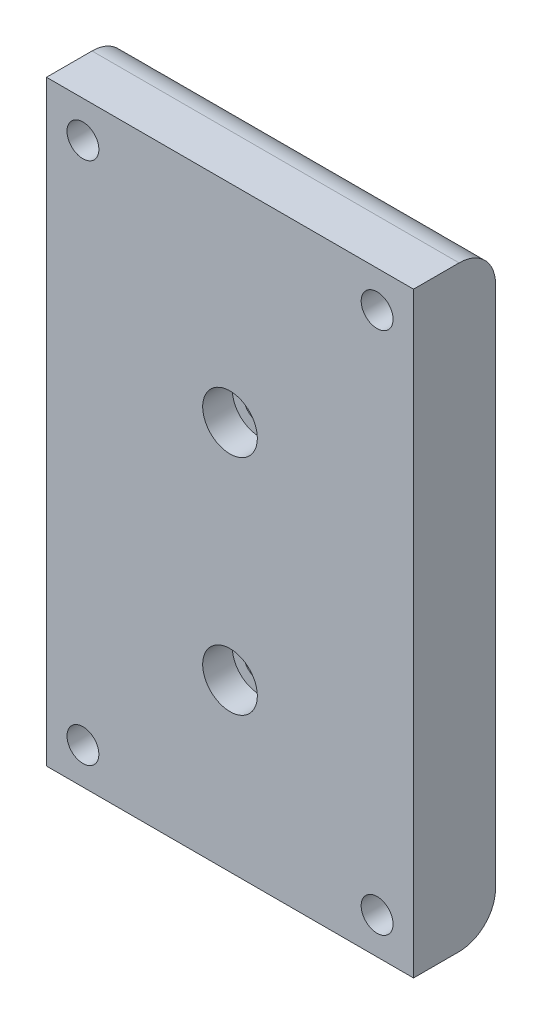
from build123d import *

# Parameters (mm, degrees)
SKETCH1_W           = 40.3
SKETCH1_H           = 65.5
BOSS_EXTRUDE1_DEPTH = 9
CUT_EXTRUDE2_DEPTH  = 4.5
SKETCH3_R           = 1.75
CUT_EXTRUDE5_DEPTH  = 78.03629015
SKETCH5_R           = 3
CUT_EXTRUDE6_DEPTH  = 3.25
FILLET1_R           = 4
SKETCH6_R           = 1.75
CUT_EXTRUDE7_DEPTH  = 78.429580911
SKETCH7_R           = 3
CUT_EXTRUDE8_DEPTH  = 3


with BuildPart() as part:
    # Sketch1 → Boss-Extrude1 (new body)
    with BuildSketch(Plane.XY):
        with Locations((20.15, 32.75)):
            Rectangle(SKETCH1_W, SKETCH1_H)
    extrude(amount=BOSS_EXTRUDE1_DEPTH)

    # Sketch2 → Cut-Extrude2 (cut)
    with BuildSketch(Plane(origin=(0, 0, 0), x_dir=(-1, 0, 0), z_dir=(0, 0, -1))):
        with BuildLine():
            Line((-24.65, 18.25), (-24.65, 32.084635496))
            ThreePointArc((-24.65, 32.084635496), (-25.148538124, 35.202683318), (-26.594444444, 38.009837998))
            ThreePointArc((-26.594444444, 38.009837998), (-20.15, 50.75), (-13.705555556, 38.009837998))
            ThreePointArc((-13.705555556, 38.009837998), (-15.151461876, 35.202683318), (-15.65, 32.084635496))
            Line((-15.65, 32.084635496), (-15.65, 18.25))
            ThreePointArc((-15.65, 18.25), (-20.15, 13.75), (-24.65, 18.25))
        make_face()
    extrude(amount=-CUT_EXTRUDE2_DEPTH, mode=Mode.SUBTRACT)

    # Sketch3 → Cut-Extrude5 (cut, through all)
    with BuildSketch(Plane(origin=(0, 0, 4.5), x_dir=(-1, 0, 0), z_dir=(0, 0, -1))):
        with Locations((-20.15, 18.25)):
            Circle(SKETCH3_R)
        with Locations((-20.15, 42.75)):
            Circle(SKETCH3_R)
    extrude(amount=-CUT_EXTRUDE5_DEPTH, mode=Mode.SUBTRACT)

    # Sketch5 → Cut-Extrude6 (cut)
    with BuildSketch(Plane.XY.offset(9)):
        with Locations((20.15, 18.25)):
            Circle(SKETCH5_R)
        with Locations((20.15, 42.75)):
            Circle(SKETCH5_R)
    extrude(amount=-CUT_EXTRUDE6_DEPTH, mode=Mode.SUBTRACT)

    # Fillet1
    fillet1_edges = [part.edges().sort_by_distance(p)[0] for p in [
        (20.15, 0, 0),
        (20.15, 65.5, 0),
    ]]
    fillet(fillet1_edges, radius=FILLET1_R)

    # Sketch6 → Cut-Extrude7 (cut, through all)
    with BuildSketch(Plane(origin=(0, 0, 0), x_dir=(-1, 0, 0), z_dir=(0, 0, -1))):
        with Locations((-36.3, 61.5)):
            Circle(SKETCH6_R)
        with Locations((-4, 61.5)):
            Circle(SKETCH6_R)
        with Locations((-4, 4)):
            Circle(SKETCH6_R)
        with Locations((-36.3, 4)):
            Circle(SKETCH6_R)
    extrude(amount=-CUT_EXTRUDE7_DEPTH, mode=Mode.SUBTRACT)

    # Sketch7 → Cut-Extrude8 (cut)
    with BuildSketch(Plane(origin=(0, 0, 0), x_dir=(-1, 0, 0), z_dir=(0, 0, -1))):
        with Locations((-36.3, 61.5)):
            Circle(SKETCH7_R)
        with Locations((-4, 61.5)):
            Circle(SKETCH7_R)
        with Locations((-4, 4)):
            Circle(SKETCH7_R)
        with Locations((-36.3, 4)):
            Circle(SKETCH7_R)
    extrude(amount=-CUT_EXTRUDE8_DEPTH, mode=Mode.SUBTRACT)


solid = part.part
